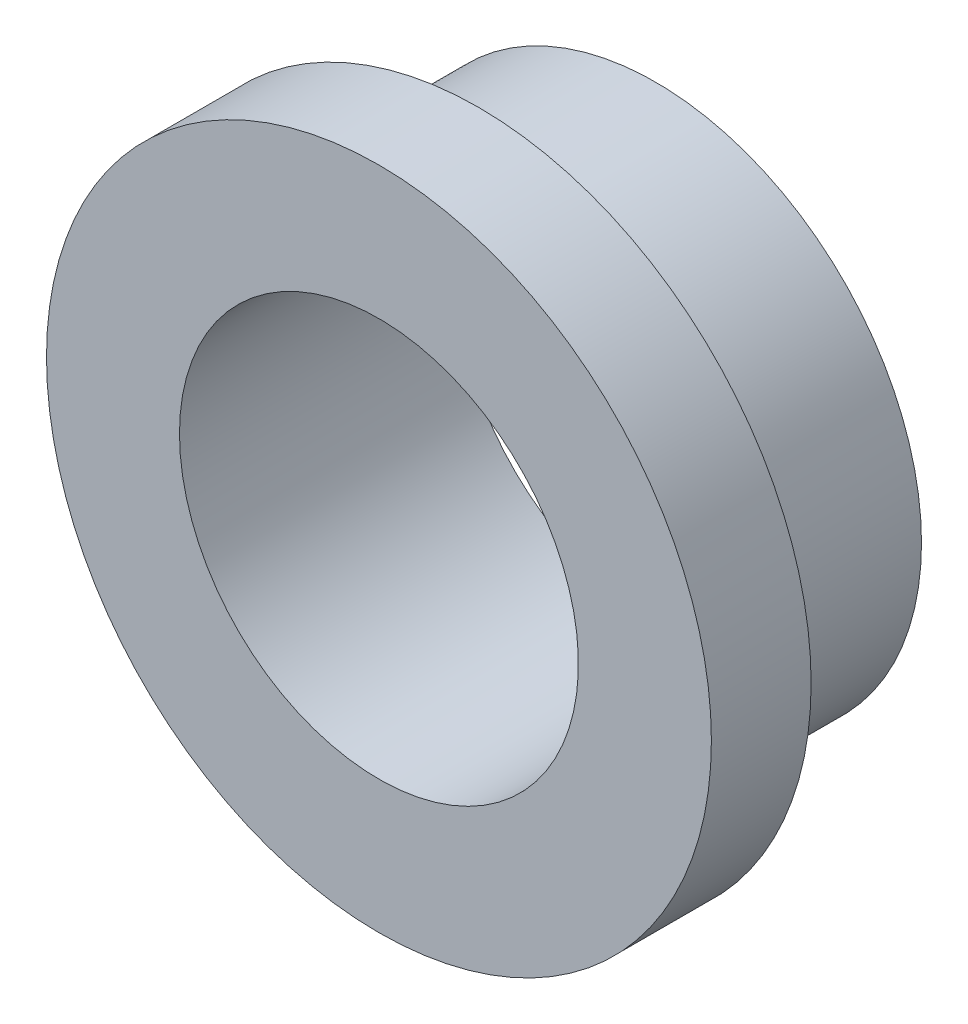
from build123d import *


with BuildPart() as part:
    # Sketch1 → Revolve1 (revolve)
    with BuildSketch(Plane(origin=(0, 0, 0), x_dir=(0, 0, -1), z_dir=(1, 0, 0))):
        Polygon((0, 15.875), (4.7625, 15.875), (4.7625, 12.7), (13.208, 12.7), (13.208, 9.525), (0, 9.525), align=None)
    revolve(axis=Axis((0, 0, 0), (0, 0, 1)))


solid = part.part
